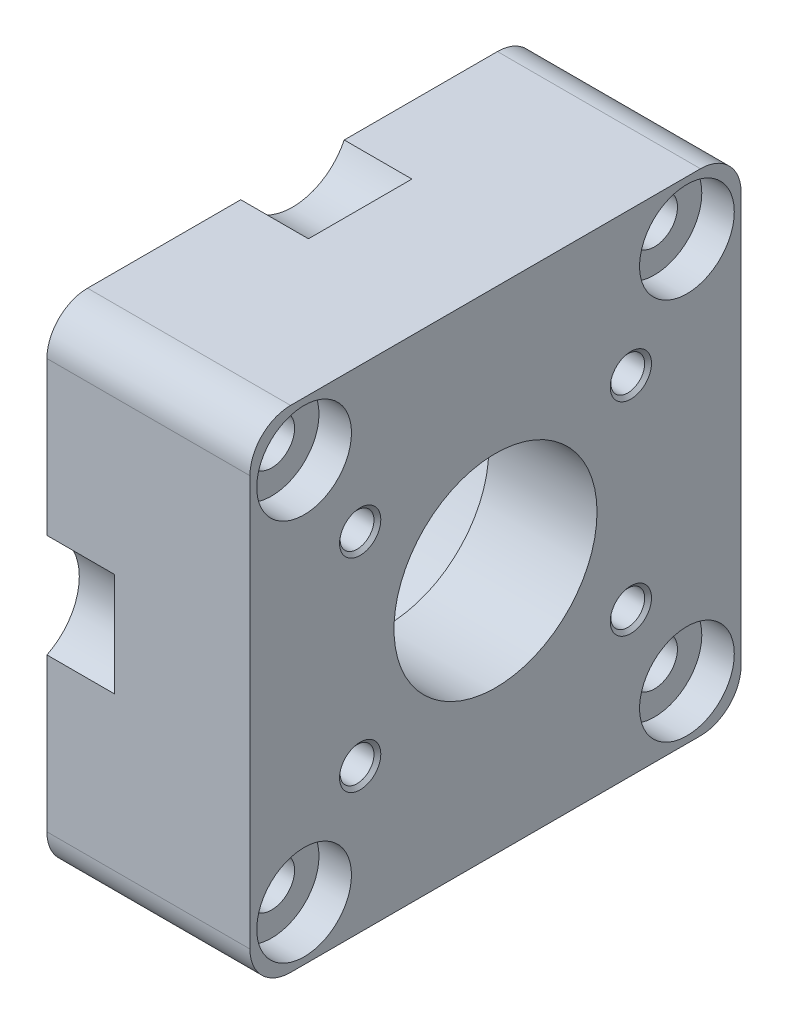
from build123d import *

# Parameters (mm, degrees)
SKETCH1_W                                        = 36.284271248
SKETCH1_H                                        = 36.284271248
BOSS_EXTRUDE1_DEPTH                              = 15
CUT_EXTRUDE1_DEPTH                               = 7
CUT_EXTRUDE1_DEPTH_BACK                          = 30.719928835
SKETCH1_4_R                                      = 13.5
SKETCH1_4_R_2                                    = 7.5
CUT_EXTRUDE2_DEPTH                               = 30.719928835
CUT_EXTRUDE2_DEPTH_BACK                          = 30.719928835
SKETCH1_5_R                                      = 7.5
FILLET1_R                                        = 3
CBORE_FOR_M3_PAN_HEAD_MACHINE_SCREW1_D           = 3.4
CBORE_FOR_M3_PAN_HEAD_MACHINE_SCREW1_CBORE_D     = 7
CBORE_FOR_M3_PAN_HEAD_MACHINE_SCREW1_CBORE_DEPTH = 2.4
SKETCH1_6_R                                      = 4.25
CUT_EXTRUDE3_DEPTH                               = 5


# Read off the part's stored shape, not the designer's step: M3x0.5 Tapped Hole1
with BuildPart() as part:
    # Sketch1 → Boss-Extrude1 (new body)
    with BuildSketch(Plane(origin=(0, 0, 0), x_dir=(0, 0, -1), z_dir=(1, 0, 0))):
        Rectangle(SKETCH1_W, SKETCH1_H)
    extrude(amount=BOSS_EXTRUDE1_DEPTH)

    # Sketch1<4> → Cut-Extrude1 (cut, two sides: drawn at the far end of the back side and taken through both)
    with BuildSketch(Plane(origin=(0, 0, 0), x_dir=(0, 0, -1), z_dir=(1, 0, 0)).offset(-CUT_EXTRUDE1_DEPTH_BACK)):
        with Locations(Location((0, 0, 0), (0, 0, 180))):
            Circle(SKETCH1_4_R)
        with Locations(Location((0, 0, 0), (0, 0, 180))):
            Circle(SKETCH1_4_R_2, mode=Mode.SUBTRACT)
    extrude(amount=CUT_EXTRUDE1_DEPTH + CUT_EXTRUDE1_DEPTH_BACK, mode=Mode.SUBTRACT)

    # Sketch1<5> → Cut-Extrude2 (cut, two sides: drawn at the far end of the back side and taken through both)
    with BuildSketch(Plane(origin=(0, 0, 0), x_dir=(0, 0, -1), z_dir=(1, 0, 0)).offset(-CUT_EXTRUDE2_DEPTH_BACK)):
        Circle(SKETCH1_5_R)
    extrude(amount=CUT_EXTRUDE2_DEPTH + CUT_EXTRUDE2_DEPTH_BACK, mode=Mode.SUBTRACT)

    # M3x0.5 Tapped Hole1 outline → M3x0.5 Tapped Hole1 (revolve, cut)
    with BuildSketch(Plane(origin=(0, -7.5, -10), x_dir=(0, 1, 0), z_dir=(0, 0, -1))):
        Polygon((0, 15), (0, 9.248924226), (1.25, 10), (1.25, 14.769247601), (1.525, 15), align=None)
    revolve(axis=Axis((0, -7.5, -10), (1, 0, 0)), mode=Mode.SUBTRACT)

    # M3x0.5 Tapped Hole1 2 outline → M3x0.5 Tapped Hole1 2 (revolve, cut)
    with BuildSketch(Plane(origin=(0, 7.5, 10), x_dir=(0, 1, 0), z_dir=(0, 0, -1))):
        Polygon((0, 15), (0, 9.248924226), (1.25, 10), (1.25, 14.769247601), (1.525, 15), align=None)
    revolve(axis=Axis((0, 7.5, 10), (1, 0, 0)), mode=Mode.SUBTRACT)

    # M3x0.5 Tapped Hole1 3 outline → M3x0.5 Tapped Hole1 3 (revolve, cut)
    with BuildSketch(Plane(origin=(0, -7.5, 10), x_dir=(0, 1, 0), z_dir=(0, 0, -1))):
        Polygon((0, 15), (0, 9.248924226), (1.25, 10), (1.25, 14.769247601), (1.525, 15), align=None)
    revolve(axis=Axis((0, -7.5, 10), (1, 0, 0)), mode=Mode.SUBTRACT)

    # M3x0.5 Tapped Hole1 4 outline → M3x0.5 Tapped Hole1 4 (revolve, cut)
    with BuildSketch(Plane(origin=(0, 7.5, -10), x_dir=(0, 1, 0), z_dir=(0, 0, -1))):
        Polygon((0, 15), (0, 9.248924226), (1.25, 10), (1.25, 14.769247601), (1.525, 15), align=None)
    revolve(axis=Axis((0, 7.5, -10), (1, 0, 0)), mode=Mode.SUBTRACT)

    # Fillet1
    fillet1_edges = [part.edges().sort_by_distance(p)[0] for p in [
        (7.5, -18.142135624, 18.142135624),
        (7.5, -18.142135624, -18.142135624),
        (7.5, 18.142135624, -18.142135624),
        (7.5, 18.142135624, 18.142135624),
    ]]
    fillet(fillet1_edges, radius=FILLET1_R)

    # CBORE for M3 Pan Head Machine Screw1 (through all)
    with Locations(Plane(origin=(15, 0, 0), x_dir=(0, 0, -1), z_dir=(1, 0, 0))):
        with Locations((14.142135624, 14.142135624), (-14.142135624, 14.142135624), (-14.142135624, -14.142135624), (14.142135624, -14.142135624)):
            CounterBoreHole(CBORE_FOR_M3_PAN_HEAD_MACHINE_SCREW1_D / 2, CBORE_FOR_M3_PAN_HEAD_MACHINE_SCREW1_CBORE_D / 2, CBORE_FOR_M3_PAN_HEAD_MACHINE_SCREW1_CBORE_DEPTH)

    # Sketch1<6> → Cut-Extrude3 (cut)
    with BuildSketch(Plane(origin=(0, 0, 0), x_dir=(0, 0, -1), z_dir=(1, 0, 0))):
        with Locations((0, 20)):
            Circle(SKETCH1_6_R)
        with Locations((0, -20)):
            Circle(SKETCH1_6_R)
        with Locations((20, 0)):
            Circle(SKETCH1_6_R)
        with Locations((-20, 0)):
            Circle(SKETCH1_6_R)
    extrude(amount=CUT_EXTRUDE3_DEPTH, mode=Mode.SUBTRACT)


solid = part.part
